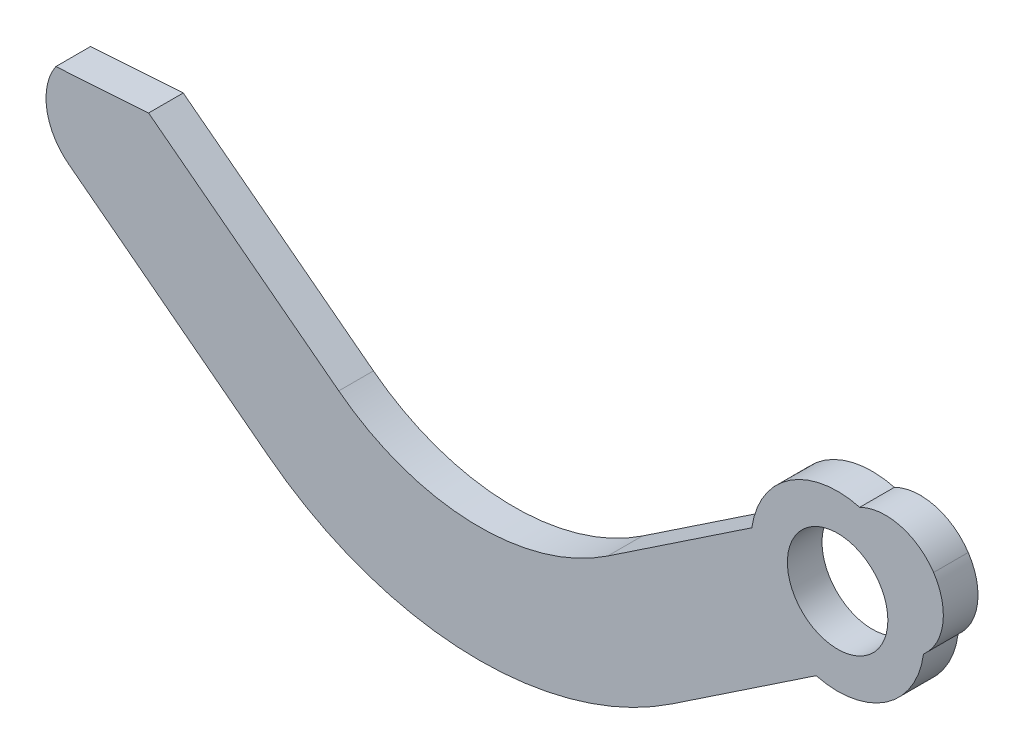
from build123d import *

# Parameters (mm, degrees)
EXTRU_MINCE1_DEPTH      = 3
CONG_1_R                = 5
ESQUISSE2_R             = 7.5
BOSS_EXTRU_1_DEPTH      = 3
ESQUISSE3_R             = 4.35
ENL_V_MAT_EXTRU_1_DEPTH = 6
ENL_V_MAT_EXTRU_2_DEPTH = 10


with BuildPart() as part:
    # Esquisse1 → Extru.-Mince1 (new body)
    with BuildSketch(Plane.XY):
        with BuildLine():
            Line((-70, 0), (-48.719716507, -16.290501455))
            ThreePointArc((-48.719716507, -16.290501455), (-37.196582195, -20.399539826), (-25.436213508, -17.028998471))
            Line((-25.436213508, -17.028998471), (0, 0))
            Line((0, 0), (5.563167687, -8.309703081))
            Line((5.563167687, -8.309703081), (-19.873045821, -25.338701551))
            ThreePointArc((-19.873045821, -25.338701551), (-37.513598853, -30.394513585), (-54.79830032, -24.230956028))
            Line((-54.79830032, -24.230956028), (-76.078583813, -7.940454573))
            Line((-76.078583813, -7.940454573), (-70, 0))
        make_face()
    extrude(amount=EXTRU_MINCE1_DEPTH)

    # Congé1
    cong_1_edges = [part.edges().sort_by_distance(p)[0] for p in [
        (-76.078583813, -7.940454573, 1.5),
        (5.563167687, -8.309703081, 1.5),
        (0, 0, 1.5),
    ]]
    fillet(cong_1_edges, radius=CONG_1_R - 0.0001)  # a hair under: the kernel refuses the full size

    # Esquisse2 → Boss.-Extru.1 (add)
    with BuildSketch(Plane.XY.offset(3)):
        with Locations((-5.528119238, -9.718019227)):
            Circle(ESQUISSE2_R)
    extrude(amount=-BOSS_EXTRU_1_DEPTH)

    # Esquisse3 → Enlèv. mat.-Extru.1 (cut)
    with BuildSketch(Plane.XY.offset(3)):
        with Locations((-5.528119238, -9.718019227)):
            Circle(ESQUISSE3_R)
    extrude(amount=-ENL_V_MAT_EXTRU_1_DEPTH, mode=Mode.SUBTRACT)

    # Esquisse4 → Enlèv. mat.-Extru.2 (cut)
    with BuildSketch(Plane.XY.offset(3)):
        Polygon((-73.230010145, -4.219362538), (-65.186412562, -3.684901716), (-70, 0), align=None)
    extrude(amount=-ENL_V_MAT_EXTRU_2_DEPTH, mode=Mode.SUBTRACT)


solid = part.part
